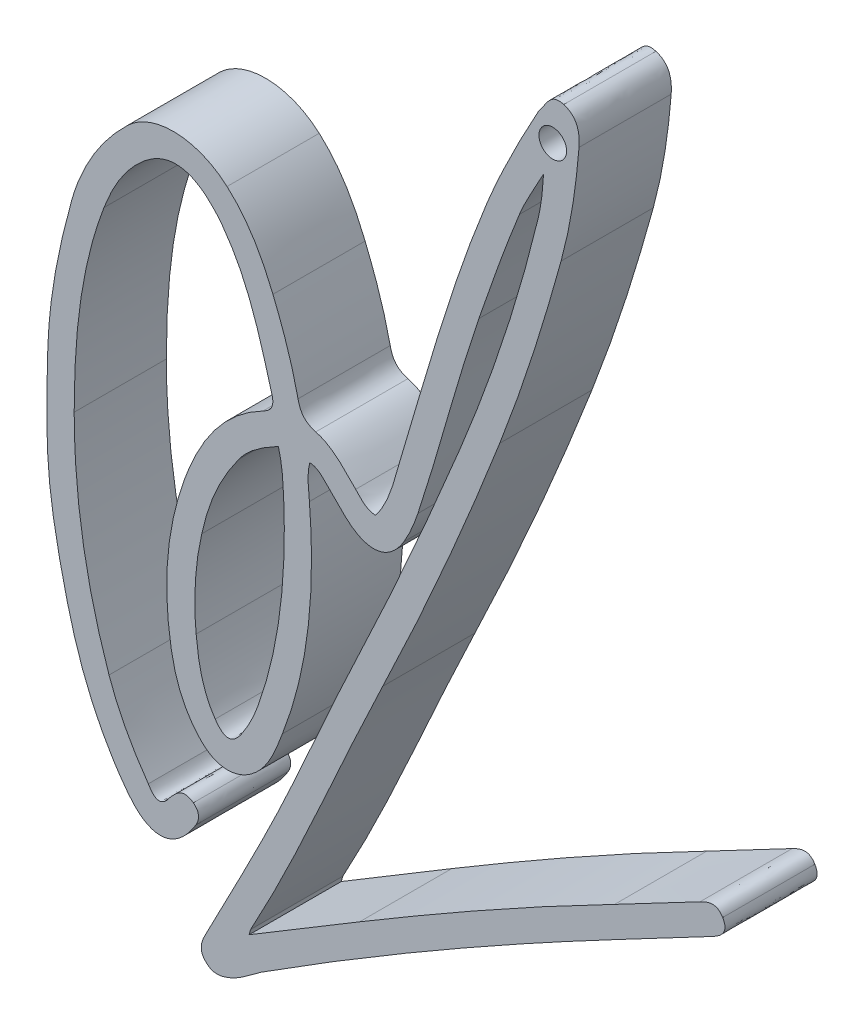
from build123d import *

# Parameters (mm, degrees)
DODANIE_WYCI_GNI_CIE1_DEPTH = 4
SZKIC2_R                    = 0.6
WYTNIJ_WYCI_GNI_CIE1_DEPTH  = 5


with BuildPart() as part:
    # Model → Dodanie-wyciągnięcie1 (new body)
    with BuildSketch(Plane.XY):
        with BuildLine():
            add(Edge.make_bspline(
                [(23.884104555, 20.003502289), (24.181685572, 19.483464557), (24.473066298, 19.469784775), (24.796553729, 19.921133388)],
                knots=[0, 0, 0, 0, 1, 1, 1, 1], degree=3))
            add(Edge.make_bspline(
                [(24.796553729, 19.921133388), (24.868741195, 20.02185275), (24.96478988, 20.105779921), (25.051957355, 20.19538967)],
                knots=[0, 0, 0, 0, 1, 1, 1, 1], degree=3))
            add(Edge.make_bspline(
                [(25.051957355, 20.19538967), (25.29376717, 20.443982061), (25.571836657, 20.46789684), (25.83726529, 20.263471599)],
                knots=[0, 0, 0, 0, 1, 1, 1, 1], degree=3))
            add(Edge.make_bspline(
                [(25.83726529, 20.263471599), (26.11028229, 20.053199468), (26.122925145, 19.772366844), (25.946634725, 19.484262714)],
                knots=[0, 0, 0, 0, 1, 1, 1, 1], degree=3))
            add(Edge.make_bspline(
                [(25.946634725, 19.484262714), (25.10133367, 18.102815136), (24.014717361, 17.877946682), (22.99495709, 19.226539079)],
                knots=[0, 0, 0, 0, 1, 1, 1, 1], degree=3))
            add(Edge.make_bspline(
                [(22.99495709, 19.226539079), (21.666903389, 20.982851551), (20.875462239, 22.985743753), (20.362735934, 25.108469522)],
                knots=[0, 0, 0, 0, 1, 1, 1, 1], degree=3))
            add(Edge.make_bspline(
                [(20.362735934, 25.108469522), (19.953509274, 26.802695997), (19.594015959, 28.517388586), (19.515540604, 30.253844011)],
                knots=[0, 0, 0, 0, 1, 1, 1, 1], degree=3))
            add(Edge.make_bspline(
                [(19.515540604, 30.253844011), (19.455923536, 31.572974455), (19.477562231, 32.904564546), (19.523944396, 34.233571079)],
                knots=[0, 0, 0, 0, 1, 1, 1, 1], degree=3))
            add(Edge.make_bspline(
                [(19.523944396, 34.233571079), (19.595513034, 36.284334888), (20.006513709, 38.255552), (20.545698181, 40.214452752)],
                knots=[0, 0, 0, 0, 1, 1, 1, 1], degree=3))
            add(Edge.make_bspline(
                [(20.545698181, 40.214452752), (20.981155875, 41.796508362), (21.795937151, 43.152022744), (22.982117511, 44.290728823)],
                knots=[0, 0, 0, 0, 1, 1, 1, 1], degree=3))
            add(Edge.make_bspline(
                [(22.982117511, 44.290728823), (24.110724123, 45.374165647), (26.011888693, 45.302770831), (27.30017086, 44.153417287)],
                knots=[0, 0, 0, 0, 1, 1, 1, 1], degree=3))
            add(Edge.make_bspline(
                [(27.30017086, 44.153417287), (28.245962268, 43.309617186), (28.825542608, 42.237958111), (29.290947181, 41.099385808)],
                knots=[0, 0, 0, 0, 1, 1, 1, 1], degree=3))
            add(Edge.make_bspline(
                [(29.290947181, 41.099385808), (29.739276866, 40.002589941), (30.130620971, 38.880815587), (30.380460153, 37.717366162)],
                knots=[0, 0, 0, 0, 1, 1, 1, 1], degree=3))
            add(Edge.make_bspline(
                [(30.380460153, 37.717366162), (30.474288191, 37.280428537), (30.66073139, 36.990800676), (31.149817853, 36.85806446)],
                knots=[0, 0, 0, 0, 1, 1, 1, 1], degree=3))
            add(Edge.make_bspline(
                [(31.149817853, 36.85806446), (31.876178981, 36.660931624), (32.370587237, 36.089460992), (32.881295125, 35.566427233)],
                knots=[0, 0, 0, 0, 1, 1, 1, 1], degree=3))
            add(Edge.make_bspline(
                [(32.881295125, 35.566427233), (33.110639661, 35.331545159), (33.313518146, 35.048776212), (33.739355668, 35.019797432)],
                knots=[0, 0, 0, 0, 1, 1, 1, 1], degree=3))
            add(Edge.make_bspline(
                [(33.739355668, 35.019797432), (34.380991469, 35.823459583), (34.576869756, 36.839679585), (34.86495086, 37.804380839)],
                knots=[0, 0, 0, 0, 1, 1, 1, 1], degree=3))
            add(Edge.make_bspline(
                [(34.86495086, 37.804380839), (36.007178063, 41.629425647), (37.06461499, 45.481669588), (38.583876174, 49.182782927)],
                knots=[0, 0, 0, 0, 1, 1, 1, 1], degree=3))
            add(Edge.make_bspline(
                [(38.583876174, 49.182782927), (39.224545753, 50.743522709), (39.990349918, 52.244784831), (40.805789942, 53.720844086)],
                knots=[0, 0, 0, 0, 1, 1, 1, 1], degree=3))
            add(Edge.make_bspline(
                [(40.805789942, 53.720844086), (40.825832199, 53.757122153), (40.851595452, 53.790693272), (40.877725246, 53.82307967)],
                knots=[0, 0, 0, 0, 1, 1, 1, 1], degree=3))
            add(Edge.make_bspline(
                [(40.877725246, 53.82307967), (41.153444189, 54.164823081), (41.332744027, 54.712615702), (41.909521184, 54.539420046)],
                knots=[0, 0, 0, 0, 1, 1, 1, 1], degree=3))
            add(Edge.make_bspline(
                [(41.909521184, 54.539420046), (42.517129473, 54.356966252), (42.614499533, 53.787702), (42.571688172, 53.260044367)],
                knots=[0, 0, 0, 0, 1, 1, 1, 1], degree=3))
            add(Edge.make_bspline(
                [(42.571688172, 53.260044367), (42.444029346, 51.686551855), (42.213921067, 50.123763247), (41.793888513, 48.599536299)],
                knots=[0, 0, 0, 0, 1, 1, 1, 1], degree=3))
            add(Edge.make_bspline(
                [(41.793888513, 48.599536299), (41.031743127, 45.83382845), (40.172865282, 43.100788569), (39.132659921, 40.422292121)],
                knots=[0, 0, 0, 0, 1, 1, 1, 1], degree=3))
            add(Edge.make_bspline(
                [(39.132659921, 40.422292121), (37.594777092, 36.462315228), (35.903288851, 32.56864237), (34.053593347, 28.748864042)],
                knots=[0, 0, 0, 0, 1, 1, 1, 1], degree=3))
            add(Edge.make_bspline(
                [(34.053593347, 28.748864042), (32.121731421, 24.759398416), (30.460171037, 20.641025045), (28.324298215, 16.749563449)],
                knots=[0, 0, 0, 0, 1, 1, 1, 1], degree=3))
            add(Edge.make_bspline(
                [(28.324298215, 16.749563449), (28.29717742, 16.700148966), (28.291889917, 16.638758009), (28.258059003, 16.516762863)],
                knots=[0, 0, 0, 0, 1, 1, 1, 1], degree=3))
            add(Edge.make_bspline(
                [(28.258059003, 16.516762863), (29.888828425, 17.497715946), (31.467624459, 18.452352146), (33.051207804, 19.398975999)],
                knots=[0, 0, 0, 0, 1, 1, 1, 1], degree=3))
            add(Edge.make_bspline(
                [(33.051207804, 19.398975999), (36.67970982, 21.567984695), (40.355025617, 23.653238166), (44.115593589, 25.586543731)],
                knots=[0, 0, 0, 0, 1, 1, 1, 1], degree=3))
            add(Edge.make_bspline(
                [(44.115593589, 25.586543731), (45.356279212, 26.224383472), (46.585385563, 26.884755548), (47.819555913, 27.535262922)],
                knots=[0, 0, 0, 0, 1, 1, 1, 1], degree=3))
            add(Edge.make_bspline(
                [(47.819555913, 27.535262922), (48.172449985, 27.721265246), (48.561830986, 27.858792402), (48.806336988, 27.438076196)],
                knots=[0, 0, 0, 0, 1, 1, 1, 1], degree=3))
            add(Edge.make_bspline(
                [(48.806336988, 27.438076196), (49.069708911, 26.984886743), (48.764610234, 26.716702731), (48.371639281, 26.508301975)],
                knots=[0, 0, 0, 0, 1, 1, 1, 1], degree=3))
            add(Edge.make_bspline(
                [(48.371639281, 26.508301975), (45.615148648, 25.046494277), (42.843030521, 23.612630433), (40.113192901, 22.102439422)],
                knots=[0, 0, 0, 0, 1, 1, 1, 1], degree=3))
            add(Edge.make_bspline(
                [(40.113192901, 22.102439422), (36.273093499, 19.978036999), (32.491058652, 17.752063622), (28.796867423, 15.379973961)],
                knots=[0, 0, 0, 0, 1, 1, 1, 1], degree=3))
            add(Edge.make_bspline(
                [(28.796867423, 15.379973961), (28.325438259, 15.077262119), (27.921604097, 14.672085557), (27.386026596, 14.465785186)],
                knots=[0, 0, 0, 0, 1, 1, 1, 1], degree=3))
            add(Edge.make_bspline(
                [(27.386026596, 14.465785186), (27.039970538, 14.332485705), (26.696819028, 14.248146066), (26.397200449, 14.539420046)],
                knots=[0, 0, 0, 0, 1, 1, 1, 1], degree=3))
            add(Edge.make_bspline(
                [(26.397200449, 14.539420046), (26.073338842, 14.854253526), (26.158039266, 15.178187716), (26.35265149, 15.552987661)],
                knots=[0, 0, 0, 0, 1, 1, 1, 1], degree=3))
            add(Edge.make_bspline(
                [(26.35265149, 15.552987661), (27.426739448, 17.621536664), (28.517151817, 19.683299337), (29.522567801, 21.78537178)],
                knots=[0, 0, 0, 0, 1, 1, 1, 1], degree=3))
            add(Edge.make_bspline(
                [(29.522567801, 21.78537178), (30.652890987, 24.148585988), (31.659989257, 26.570746879), (32.790646572, 28.933793147)],
                knots=[0, 0, 0, 0, 1, 1, 1, 1], degree=3))
            add(Edge.make_bspline(
                [(32.790646572, 28.933793147), (34.426094307, 32.35183582), (35.955514151, 35.81465859), (37.398169352, 39.317476272)],
                knots=[0, 0, 0, 0, 1, 1, 1, 1], degree=3))
            add(Edge.make_bspline(
                [(37.398169352, 39.317476272), (38.786181884, 42.687620684), (39.938151398, 46.134404492), (40.792526507, 49.67807431)],
                knots=[0, 0, 0, 0, 1, 1, 1, 1], degree=3))
            add(Edge.make_bspline(
                [(40.792526507, 49.67807431), (40.932837699, 50.260042612), (41.000476626, 50.859530556), (41.033018576, 51.487959236)],
                knots=[0, 0, 0, 0, 1, 1, 1, 1], degree=3))
            add(Edge.make_bspline(
                [(41.033018576, 51.487959236), (40.680846448, 50.810891328), (40.272656716, 50.156471261), (39.987890375, 49.452151784)],
                knots=[0, 0, 0, 0, 1, 1, 1, 1], degree=3))
            add(Edge.make_bspline(
                [(39.987890375, 49.452151784), (39.349279258, 47.872678732), (38.776867182, 46.268689342), (38.225391129, 44.653840622)],
                knots=[0, 0, 0, 0, 1, 1, 1, 1], degree=3))
            add(Edge.make_bspline(
                [(38.225391129, 44.653840622), (37.250162671, 41.798146723), (36.526608605, 38.870011569), (35.580530872, 36.008719063)],
                knots=[0, 0, 0, 0, 1, 1, 1, 1], degree=3))
            add(Edge.make_bspline(
                [(35.580530872, 36.008719063), (35.424599694, 35.537121833), (35.228133364, 35.066691303), (34.972513994, 34.642673599)],
                knots=[0, 0, 0, 0, 1, 1, 1, 1], degree=3))
            add(Edge.make_bspline(
                [(34.972513994, 34.642673599), (34.309556483, 33.542975186), (33.376696383, 33.43141176), (32.438737869, 34.307232594)],
                knots=[0, 0, 0, 0, 1, 1, 1, 1], degree=3))
            add(Edge.make_bspline(
                [(32.438737869, 34.307232594), (32.134170045, 34.591620755), (31.8475725, 34.895295065), (31.553896543, 35.191281646)],
                knots=[0, 0, 0, 0, 1, 1, 1, 1], degree=3))
            add(Edge.make_bspline(
                [(31.553896543, 35.191281646), (31.378576098, 35.367982532), (31.205203491, 35.546421142), (30.890789987, 35.576576257)],
                knots=[0, 0, 0, 0, 1, 1, 1, 1], degree=3))
            add(Edge.make_bspline(
                [(30.890789987, 35.576576257), (30.76086271, 35.076267552), (30.835345282, 34.57536317), (30.873858387, 34.102079776)],
                knots=[0, 0, 0, 0, 1, 1, 1, 1], degree=3))
            add(Edge.make_bspline(
                [(30.873858387, 34.102079776), (31.133590803, 30.91030915), (30.865250238, 27.787578917), (29.699623841, 24.784730054)],
                knots=[0, 0, 0, 0, 1, 1, 1, 1], degree=3))
            add(Edge.make_bspline(
                [(29.699623841, 24.784730054), (29.388311609, 23.982736798), (29.089267807, 23.141491473), (28.338243424, 22.595071786)],
                knots=[0, 0, 0, 0, 1, 1, 1, 1], degree=3))
            add(Edge.make_bspline(
                [(28.338243424, 22.595071786), (27.626432817, 22.077188), (26.814466237, 22.12241673), (26.188948612, 22.751339096)],
                knots=[0, 0, 0, 0, 1, 1, 1, 1], degree=3))
            add(Edge.make_bspline(
                [(26.188948612, 22.751339096), (25.42322091, 23.52123328), (25.061046675, 24.510527208), (24.883725084, 25.538206221)],
                knots=[0, 0, 0, 0, 1, 1, 1, 1], degree=3))
            add(Edge.make_bspline(
                [(24.883725084, 25.538206221), (24.489112017, 27.825211647), (24.667309978, 30.082397966), (25.470490958, 32.272932729)],
                knots=[0, 0, 0, 0, 1, 1, 1, 1], degree=3))
            add(Edge.make_bspline(
                [(25.470490958, 32.272932729), (26.12520123, 34.058540965), (27.105507077, 35.592318256), (28.856702113, 36.497112238)],
                knots=[0, 0, 0, 0, 1, 1, 1, 1], degree=3))
            add(Edge.make_bspline(
                [(28.856702113, 36.497112238), (29.22327772, 36.686509666), (29.365340026, 36.904979355), (29.24433588, 37.331366876)],
                knots=[0, 0, 0, 0, 1, 1, 1, 1], degree=3))
            add(Edge.make_bspline(
                [(29.24433588, 37.331366876), (28.722105909, 39.171545323), (28.259172267, 41.034149109), (27.086509381, 42.604896629)],
                knots=[0, 0, 0, 0, 1, 1, 1, 1], degree=3))
            add(Edge.make_bspline(
                [(27.086509381, 42.604896629), (26.888648969, 42.869929939), (26.654698828, 43.116286166), (26.403515244, 43.331736927)],
                knots=[0, 0, 0, 0, 1, 1, 1, 1], degree=3))
            add(Edge.make_bspline(
                [(26.403515244, 43.331736927), (25.543839367, 44.06911982), (24.63201265, 44.06792634), (23.749097886, 43.354439204)],
                knots=[0, 0, 0, 0, 1, 1, 1, 1], degree=3))
            add(Edge.make_bspline(
                [(23.749097886, 43.354439204), (22.877873146, 42.650400422), (22.340351812, 41.700427266), (21.957602591, 40.689548079)],
                knots=[0, 0, 0, 0, 1, 1, 1, 1], degree=3))
            add(Edge.make_bspline(
                [(21.957602591, 40.689548079), (20.942577946, 38.008766035), (20.664722203, 35.213913218), (20.667422268, 32.356242949)],
                knots=[0, 0, 0, 0, 1, 1, 1, 1], degree=3))
            add(Edge.make_bspline(
                [(20.667422268, 32.356242949), (20.670385758, 29.221060827), (21.153766618, 26.188156212), (22.179150399, 23.237081887)],
                knots=[0, 0, 0, 0, 1, 1, 1, 1], degree=3))
            add(Edge.make_bspline(
                [(22.179150399, 23.237081887), (22.577192985, 22.091501753), (23.151230031, 21.027904707), (23.884104555, 20.003502289)],
                knots=[0, 0, 0, 0, 1, 1, 1, 1], degree=3))
        make_face()
        with BuildLine():
            add(Edge.make_bspline(
                [(26.203315801, 30.556425955), (25.904065889, 29.273545797), (25.836875723, 27.969479458), (25.959754997, 26.666738373)],
                knots=[0, 0, 0, 0, 1, 1, 1, 1], degree=3))
            add(Edge.make_bspline(
                [(25.959754997, 26.666738373), (26.051325847, 25.695936192), (26.208658617, 24.717366065), (26.784996651, 23.885118457)],
                knots=[0, 0, 0, 0, 1, 1, 1, 1], degree=3))
            add(Edge.make_bspline(
                [(26.784996651, 23.885118457), (27.188538606, 23.302391169), (27.538535889, 23.321337431), (27.935686712, 23.905298245)],
                knots=[0, 0, 0, 0, 1, 1, 1, 1], degree=3))
            add(Edge.make_bspline(
                [(27.935686712, 23.905298245), (28.229985251, 24.338029093), (28.460675941, 24.800494955), (28.637401731, 25.294116567)],
                knots=[0, 0, 0, 0, 1, 1, 1, 1], degree=3))
            add(Edge.make_bspline(
                [(28.637401731, 25.294116567), (29.613374784, 28.020177148), (29.880940219, 30.838224801), (29.75663445, 33.710835159)],
                knots=[0, 0, 0, 0, 1, 1, 1, 1], degree=3))
            add(Edge.make_bspline(
                [(29.75663445, 33.710835159), (29.731617794, 34.288908913), (29.69842473, 34.861592047), (29.528034759, 35.501112196)],
                knots=[0, 0, 0, 0, 1, 1, 1, 1], degree=3))
            add(Edge.make_bspline(
                [(29.528034759, 35.501112196), (28.842892433, 35.134141265), (28.246676328, 34.7558889), (27.80669312, 34.154205838)],
                knots=[0, 0, 0, 0, 1, 1, 1, 1], degree=3))
            add(Edge.make_bspline(
                [(27.80669312, 34.154205838), (27.034683159, 33.098468341), (26.495412715, 31.940867683), (26.203315801, 30.556425955)],
                knots=[0, 0, 0, 0, 1, 1, 1, 1], degree=3))
        make_face(mode=Mode.SUBTRACT)
    extrude(amount=DODANIE_WYCI_GNI_CIE1_DEPTH)

    # Szkic2 → Wytnij-wyciągnięcie1 (cut)
    with BuildSketch(Plane.XY.offset(4)):
        with Locations((41.43377757, 52.848093513)):
            Circle(SZKIC2_R)
    extrude(amount=-WYTNIJ_WYCI_GNI_CIE1_DEPTH, mode=Mode.SUBTRACT)


solid = part.part
